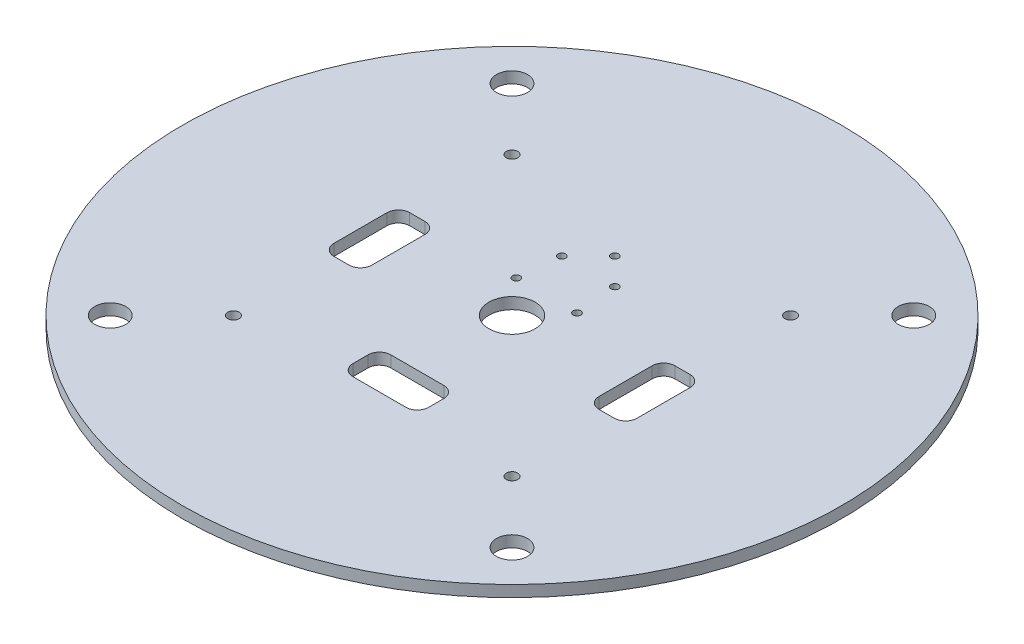
from build123d import *

# Parameters (mm, degrees)
SKETCH_1_R             = 87
SM_BASE_FLANGE_1_DEPTH = 3
CUT_EXTRUDE_1_REACH    = 125.073
SKETCH_6_R             = 6.1
SKETCH_6_R_2           = 1
SKETCH_6_R_3           = 4.1
SKETCH_6_R_4           = 1.5
SKETCH_6_W             = 10
SKETCH_6_H             = 20
SKETCH_6_W_2           = 20
SKETCH_6_H_2           = 10
FILLET_1_R             = 3


# Sheet-metal steps are written as plain solids
with BuildPart() as part:
    # Sketch 1 → 基体-法兰1 (new body)
    with BuildSketch(Plane(origin=(0, 0, 0), x_dir=(1, 0, 0), z_dir=(0, 1, 0))):
        with Locations(Location((0, 0, 0), (0, 0, 270))):
            Circle(SKETCH_1_R)
    extrude(amount=-SM_BASE_FLANGE_1_DEPTH)

    # 草图6 → 切除-拉伸1 (cut, up to next)
    with BuildSketch(Plane(origin=(0, 0, 0), x_dir=(1, 0, 0), z_dir=(0, 1, 0)), mode=Mode.PRIVATE) as cut_extrude_1_sk1:
        with Locations(Location((0, 0, 0), (0, 0, 270))):
            Circle(SKETCH_6_R)
    cut_extrude_1_tool1 = extrude(cut_extrude_1_sk1.sketch, amount=-CUT_EXTRUDE_1_REACH, mode=Mode.PRIVATE) & part.part
    # 草图6 → 切除-拉伸1 (cut, up to next)
    with BuildSketch(Plane(origin=(0, 0, 0), x_dir=(1, 0, 0), z_dir=(0, 1, 0)), mode=Mode.PRIVATE) as cut_extrude_1_sk2:
        with Locations(Location((-8, 9.15, 0), (0, 0, 270))):
            Circle(SKETCH_6_R_2)
    cut_extrude_1_tool2 = extrude(cut_extrude_1_sk2.sketch, amount=-CUT_EXTRUDE_1_REACH, mode=Mode.PRIVATE) & part.part
    # 草图6 → 切除-拉伸1 (cut, up to next)
    with BuildSketch(Plane(origin=(0, 0, 0), x_dir=(1, 0, 0), z_dir=(0, 1, 0)), mode=Mode.PRIVATE) as cut_extrude_1_sk3:
        with Locations(Location((-7, 20.15, 0), (0, 0, 270))):
            Circle(SKETCH_6_R_2)
    cut_extrude_1_tool3 = extrude(cut_extrude_1_sk3.sketch, amount=-CUT_EXTRUDE_1_REACH, mode=Mode.PRIVATE) & part.part
    # 草图6 → 切除-拉伸1 (cut, up to next)
    with BuildSketch(Plane(origin=(0, 0, 0), x_dir=(1, 0, 0), z_dir=(0, 1, 0)), mode=Mode.PRIVATE) as cut_extrude_1_sk4:
        with Locations(Location((53.033008589, 53.033008589, 0), (0, 0, 270))):
            Circle(SKETCH_6_R_3)
    cut_extrude_1_tool4 = extrude(cut_extrude_1_sk4.sketch, amount=-CUT_EXTRUDE_1_REACH, mode=Mode.PRIVATE) & part.part
    # 草图6 → 切除-拉伸1 (cut, up to next)
    with BuildSketch(Plane(origin=(0, 0, 0), x_dir=(1, 0, 0), z_dir=(0, 1, 0)), mode=Mode.PRIVATE) as cut_extrude_1_sk5:
        with Locations(Location((-53.033008589, 53.033008589, 0), (0, 0, 270))):
            Circle(SKETCH_6_R_3)
    cut_extrude_1_tool5 = extrude(cut_extrude_1_sk5.sketch, amount=-CUT_EXTRUDE_1_REACH, mode=Mode.PRIVATE) & part.part
    # 草图6 → 切除-拉伸1 (cut, up to next)
    with BuildSketch(Plane(origin=(0, 0, 0), x_dir=(1, 0, 0), z_dir=(0, 1, 0)), mode=Mode.PRIVATE) as cut_extrude_1_sk6:
        with Locations(Location((53.033008589, -53.033008589, 0), (0, 0, 270))):
            Circle(SKETCH_6_R_3)
    cut_extrude_1_tool6 = extrude(cut_extrude_1_sk6.sketch, amount=-CUT_EXTRUDE_1_REACH, mode=Mode.PRIVATE) & part.part
    # 草图6 → 切除-拉伸1 (cut, up to next)
    with BuildSketch(Plane(origin=(0, 0, 0), x_dir=(1, 0, 0), z_dir=(0, 1, 0)), mode=Mode.PRIVATE) as cut_extrude_1_sk7:
        with Locations(Location((-53.033008589, -53.033008589, 0), (0, 0, 270))):
            Circle(SKETCH_6_R_3)
    cut_extrude_1_tool7 = extrude(cut_extrude_1_sk7.sketch, amount=-CUT_EXTRUDE_1_REACH, mode=Mode.PRIVATE) & part.part
    # 草图6 → 切除-拉伸1 (cut, up to next)
    with BuildSketch(Plane(origin=(0, 0, 0), x_dir=(1, 0, 0), z_dir=(0, 1, 0)), mode=Mode.PRIVATE) as cut_extrude_1_sk8:
        with Locations(Location((8, 9.15, 0), (0, 0, 270))):
            Circle(SKETCH_6_R_2)
    cut_extrude_1_tool8 = extrude(cut_extrude_1_sk8.sketch, amount=-CUT_EXTRUDE_1_REACH, mode=Mode.PRIVATE) & part.part
    # 草图6 → 切除-拉伸1 (cut, up to next)
    with BuildSketch(Plane(origin=(0, 0, 0), x_dir=(1, 0, 0), z_dir=(0, 1, 0)), mode=Mode.PRIVATE) as cut_extrude_1_sk9:
        with Locations(Location((7, 20.15, 0), (0, 0, 270))):
            Circle(SKETCH_6_R_2)
    cut_extrude_1_tool9 = extrude(cut_extrude_1_sk9.sketch, amount=-CUT_EXTRUDE_1_REACH, mode=Mode.PRIVATE) & part.part
    # 草图6 → 切除-拉伸1 (cut, up to next)
    with BuildSketch(Plane(origin=(0, 0, 0), x_dir=(1, 0, 0), z_dir=(0, 1, 0)), mode=Mode.PRIVATE) as cut_extrude_1_sk10:
        with Locations(Location((0, 27.15, 0), (0, 0, 270))):
            Circle(SKETCH_6_R_2)
    cut_extrude_1_tool10 = extrude(cut_extrude_1_sk10.sketch, amount=-CUT_EXTRUDE_1_REACH, mode=Mode.PRIVATE) & part.part
    # 草图6 → 切除-拉伸1 (cut, up to next)
    with BuildSketch(Plane(origin=(0, 0, 0), x_dir=(1, 0, 0), z_dir=(0, 1, 0)), mode=Mode.PRIVATE) as cut_extrude_1_sk11:
        with Locations(Location((-36.769552622, -36.769552622, 0), (0, 0, 270))):
            Circle(SKETCH_6_R_4)
    cut_extrude_1_tool11 = extrude(cut_extrude_1_sk11.sketch, amount=-CUT_EXTRUDE_1_REACH, mode=Mode.PRIVATE) & part.part
    # 草图6 → 切除-拉伸1 (cut, up to next)
    with BuildSketch(Plane(origin=(0, 0, 0), x_dir=(1, 0, 0), z_dir=(0, 1, 0)), mode=Mode.PRIVATE) as cut_extrude_1_sk12:
        with Locations(Location((-36.769552622, 36.769552622, 0), (0, 0, 270))):
            Circle(SKETCH_6_R_4)
    cut_extrude_1_tool12 = extrude(cut_extrude_1_sk12.sketch, amount=-CUT_EXTRUDE_1_REACH, mode=Mode.PRIVATE) & part.part
    # 草图6 → 切除-拉伸1 (cut, up to next)
    with BuildSketch(Plane(origin=(0, 0, 0), x_dir=(1, 0, 0), z_dir=(0, 1, 0)), mode=Mode.PRIVATE) as cut_extrude_1_sk13:
        with Locations(Location((36.769552622, 36.769552622, 0), (0, 0, 270))):
            Circle(SKETCH_6_R_4)
    cut_extrude_1_tool13 = extrude(cut_extrude_1_sk13.sketch, amount=-CUT_EXTRUDE_1_REACH, mode=Mode.PRIVATE) & part.part
    # 草图6 → 切除-拉伸1 (cut, up to next)
    with BuildSketch(Plane(origin=(0, 0, 0), x_dir=(1, 0, 0), z_dir=(0, 1, 0)), mode=Mode.PRIVATE) as cut_extrude_1_sk14:
        with Locations(Location((36.769552622, -36.769552622, 0), (0, 0, 270))):
            Circle(SKETCH_6_R_4)
    cut_extrude_1_tool14 = extrude(cut_extrude_1_sk14.sketch, amount=-CUT_EXTRUDE_1_REACH, mode=Mode.PRIVATE) & part.part
    # 草图6 → 切除-拉伸1 (cut, up to next)
    with BuildSketch(Plane(origin=(0, 0, 0), x_dir=(1, 0, 0), z_dir=(0, 1, 0)), mode=Mode.PRIVATE) as cut_extrude_1_sk15:
        with Locations((-35, 0)):
            Rectangle(SKETCH_6_W, SKETCH_6_H)
    cut_extrude_1_tool15 = extrude(cut_extrude_1_sk15.sketch, amount=-CUT_EXTRUDE_1_REACH, mode=Mode.PRIVATE) & part.part
    # 草图6 → 切除-拉伸1 (cut, up to next)
    with BuildSketch(Plane(origin=(0, 0, 0), x_dir=(1, 0, 0), z_dir=(0, 1, 0)), mode=Mode.PRIVATE) as cut_extrude_1_sk16:
        with Locations((35, 0)):
            Rectangle(SKETCH_6_W, SKETCH_6_H)
    cut_extrude_1_tool16 = extrude(cut_extrude_1_sk16.sketch, amount=-CUT_EXTRUDE_1_REACH, mode=Mode.PRIVATE) & part.part
    # 草图6 → 切除-拉伸1 (cut, up to next)
    with BuildSketch(Plane(origin=(0, 0, 0), x_dir=(1, 0, 0), z_dir=(0, 1, 0)), mode=Mode.PRIVATE) as cut_extrude_1_sk17:
        with Locations((0, -30)):
            Rectangle(SKETCH_6_W_2, SKETCH_6_H_2)
    cut_extrude_1_tool17 = extrude(cut_extrude_1_sk17.sketch, amount=-CUT_EXTRUDE_1_REACH, mode=Mode.PRIVATE) & part.part
    add(cut_extrude_1_tool1.solids().sort_by_distance((0, 0, 0))[0], mode=Mode.SUBTRACT)
    add(cut_extrude_1_tool2.solids().sort_by_distance((-8, 0, -9.15))[0], mode=Mode.SUBTRACT)
    add(cut_extrude_1_tool3.solids().sort_by_distance((-7, 0, -20.15))[0], mode=Mode.SUBTRACT)
    add(cut_extrude_1_tool4.solids().sort_by_distance((53.033009, 0, -53.033009))[0], mode=Mode.SUBTRACT)
    add(cut_extrude_1_tool5.solids().sort_by_distance((-53.033009, 0, -53.033009))[0], mode=Mode.SUBTRACT)
    add(cut_extrude_1_tool6.solids().sort_by_distance((53.033009, 0, 53.033009))[0], mode=Mode.SUBTRACT)
    add(cut_extrude_1_tool7.solids().sort_by_distance((-53.033009, 0, 53.033009))[0], mode=Mode.SUBTRACT)
    add(cut_extrude_1_tool8.solids().sort_by_distance((8, 0, -9.15))[0], mode=Mode.SUBTRACT)
    add(cut_extrude_1_tool9.solids().sort_by_distance((7, 0, -20.15))[0], mode=Mode.SUBTRACT)
    add(cut_extrude_1_tool10.solids().sort_by_distance((0, 0, -27.15))[0], mode=Mode.SUBTRACT)
    add(cut_extrude_1_tool11.solids().sort_by_distance((-36.769553, 0, 36.769553))[0], mode=Mode.SUBTRACT)
    add(cut_extrude_1_tool12.solids().sort_by_distance((-36.769553, 0, -36.769553))[0], mode=Mode.SUBTRACT)
    add(cut_extrude_1_tool13.solids().sort_by_distance((36.769553, 0, -36.769553))[0], mode=Mode.SUBTRACT)
    add(cut_extrude_1_tool14.solids().sort_by_distance((36.769553, 0, 36.769553))[0], mode=Mode.SUBTRACT)
    add(cut_extrude_1_tool15.solids().sort_by_distance((-35, 0, 0))[0], mode=Mode.SUBTRACT)
    add(cut_extrude_1_tool16.solids().sort_by_distance((35, 0, 0))[0], mode=Mode.SUBTRACT)
    add(cut_extrude_1_tool17.solids().sort_by_distance((0, 0, 30))[0], mode=Mode.SUBTRACT)

    # 圆角1
    fillet_1_edges = [part.edges().sort_by_distance(p)[0] for p in [
        (-10, -1.5, 35),
        (-10, -1.5, 25),
        (10, -1.5, 25),
        (10, -1.5, 35),
        (-30, -1.5, -10),
        (-30, -1.5, 10),
        (-40, -1.5, 10),
        (-40, -1.5, -10),
        (40, -1.5, -10),
        (40, -1.5, 10),
        (30, -1.5, 10),
        (30, -1.5, -10),
    ]]
    fillet(fillet_1_edges, radius=FILLET_1_R)


solid = part.part
